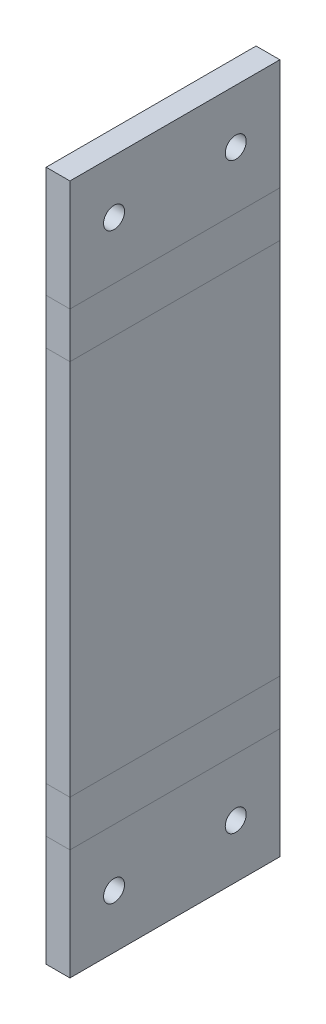
from build123d import *

# Parameters (mm, degrees)
SKETCH11_W                     = 3.4
SKETCH11_H                     = 62.2
BASE_FLANGE3_DEPTH             = 30
EDGE_FLANGE1_STRIP_W           = 15.1
EDGE_FLANGE1_STRIP_H           = 3.4
EDGE_FLANGE1_STRIP_CUT_DEPTH   = 30
EDGE_FLANGE1_STRIP_2_W         = 15.1
EDGE_FLANGE1_STRIP_2_H         = 3.4
EDGE_FLANGE1_STRIP_CUT_2_DEPTH = 30
EDGE_FLANGE1_DEPTH             = 30
EDGE_FLANGE1_BEND_DEPTH        = 30
SKETCH22_R                     = 1.5
CUT_EXTRUDE1_DEPTH             = 72.894645141
UNFOLD1_START                  = -20
UNFOLD1_OUTLINE_W              = 62.2
UNFOLD1_OUTLINE_H              = 30
UNFOLD1_DEPTH                  = 16.6
UNFOLD1_START_2                = -3.4
UNFOLD1_2_OUTLINE_W            = 98.637609512
UNFOLD1_2_OUTLINE_H            = 30
UNFOLD1_2_OUTLINE_R            = 1.5
UNFOLD1_2_DEPTH                = 3.4


# Read off the part's stored shape, not the designer's step: Unfold1
# Sheet-metal steps are written as plain solids
with BuildPart() as part:
    # Sketch11 → Base-Flange3 (new body)
    with BuildSketch(Plane.XY):
        with Locations((-1.7, 0)):
            Rectangle(SKETCH11_W, SKETCH11_H)
    extrude(amount=BASE_FLANGE3_DEPTH)

    # Edge-Flange1 strip (across the edge) → Edge-Flange1 strip cut (cut)
    with BuildSketch(Plane(origin=(-3.4, 31.1, 30), x_dir=(0, -1, 0), z_dir=(0, 0, -1))):
        with Locations((-3.4, -1.7)):
            Rectangle(EDGE_FLANGE1_STRIP_W, EDGE_FLANGE1_STRIP_H)
    extrude(amount=EDGE_FLANGE1_STRIP_CUT_DEPTH, mode=Mode.SUBTRACT)

    # Edge-Flange1 strip 2 (across the edge) → Edge-Flange1 strip cut 2 (cut)
    with BuildSketch(Plane(origin=(-3.4, -31.1, 0), x_dir=(0, 1, 0), z_dir=(0, 0, 1))):
        with Locations((-3.4, -1.7)):
            Rectangle(EDGE_FLANGE1_STRIP_2_W, EDGE_FLANGE1_STRIP_2_H)
    extrude(amount=EDGE_FLANGE1_STRIP_CUT_2_DEPTH, mode=Mode.SUBTRACT)

    # Edge-Flange1 section (across the edge) → Edge-Flange1 (add)
    with BuildSketch(Plane(origin=(-3.4, 31.1, 30), x_dir=(0, -1, 0), z_dir=(0, 0, -1))):
        with BuildLine():
            Line((0, 0.75), (0, 16.6))
            Line((0, 16.6), (3.4, 16.6))
            Line((3.4, 16.6), (3.4, 0.75))
            ThreePointArc((3.4, 0.75), (3.619669914, 0.219669914), (4.15, 0))
            Line((4.15, 0), (4.15, -3.4))
            ThreePointArc((4.15, -3.4), (1.215506858, -2.184493142), (0, 0.75))
        make_face()
    extrude(amount=EDGE_FLANGE1_DEPTH)

    # Edge-Flange1 section 2 (across the edge) → Edge-Flange1 bend (add)
    with BuildSketch(Plane(origin=(-3.4, -31.1, 0), x_dir=(0, 1, 0), z_dir=(0, 0, 1))):
        with BuildLine():
            Line((0, 0.75), (0, 16.6))
            Line((0, 16.6), (3.4, 16.6))
            Line((3.4, 16.6), (3.4, 0.75))
            ThreePointArc((3.4, 0.75), (3.619669914, 0.219669914), (4.15, 0))
            Line((4.15, 0), (4.15, -3.4))
            ThreePointArc((4.15, -3.4), (1.215506858, -2.184493142), (0, 0.75))
        make_face()
    extrude(amount=EDGE_FLANGE1_BEND_DEPTH)

    # Sketch22 → Cut-Extrude1 (cut, through all)
    with BuildSketch(Plane(origin=(0, 31.1, 0), x_dir=(1, 0, 0), z_dir=(0, 1, 0))):
        with Locations(Location((-12.329371406, -23.693332437, 0), (0, 0, 180))):
            Circle(SKETCH22_R)
        with Locations(Location((-12.329371406, -6.306667563, 0), (0, 0, 180))):
            Circle(SKETCH22_R)
    extrude(amount=-CUT_EXTRUDE1_DEPTH, mode=Mode.SUBTRACT)

    # Unfold1 outline → Unfold1 (cut)
    with BuildSketch(Plane.YZ.offset(UNFOLD1_START)):
        with Locations((0, 15)):
            Rectangle(UNFOLD1_OUTLINE_W, UNFOLD1_OUTLINE_H)
    extrude(amount=UNFOLD1_DEPTH, mode=Mode.SUBTRACT)

    # Unfold1 2 outline → Unfold1 2 (add)
    with BuildSketch(Plane.YZ.offset(UNFOLD1_START_2)):
        with Locations((0, 15)):
            Rectangle(UNFOLD1_2_OUTLINE_W, UNFOLD1_2_OUTLINE_H)
        with Locations((41.648176162, 23.693332437)):
            Circle(UNFOLD1_2_OUTLINE_R, mode=Mode.SUBTRACT)
        with Locations((41.648176162, 6.306667563)):
            Circle(UNFOLD1_2_OUTLINE_R, mode=Mode.SUBTRACT)
        with Locations((-41.648176162, 23.693332437)):
            Circle(UNFOLD1_2_OUTLINE_R, mode=Mode.SUBTRACT)
        with Locations((-41.648176162, 6.306667563)):
            Circle(UNFOLD1_2_OUTLINE_R, mode=Mode.SUBTRACT)
    extrude(amount=UNFOLD1_2_DEPTH)


solid = part.part
